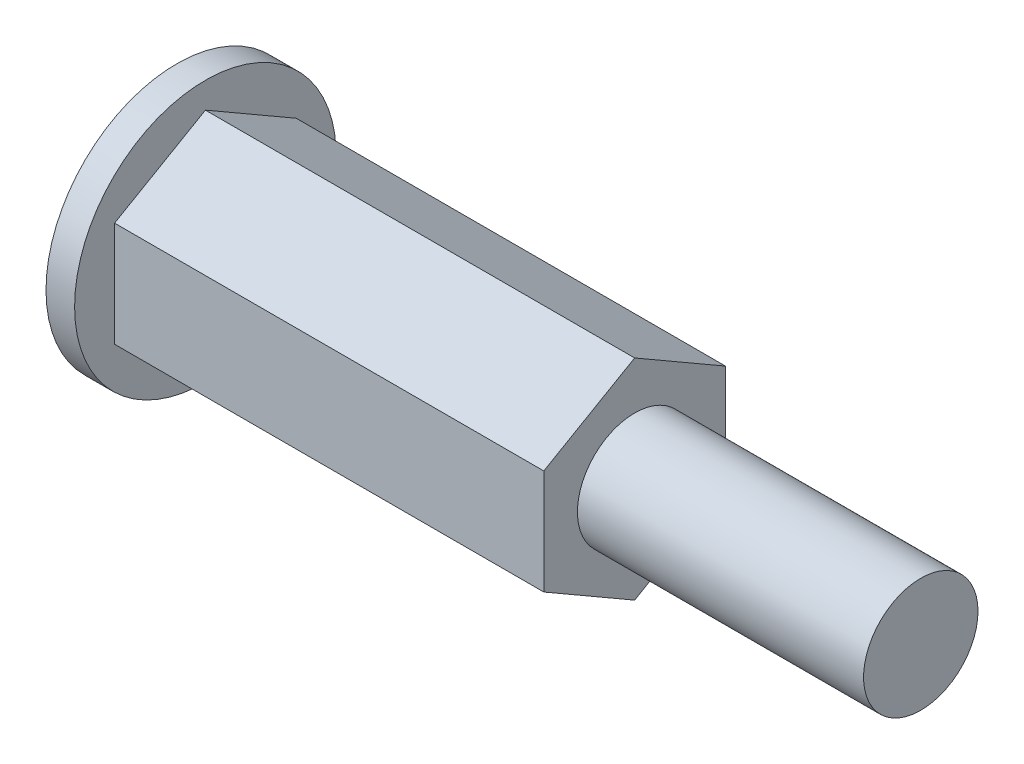
from build123d import *

# Parameters (mm, degrees)
SKETCH1_R           = 3.999
BOSS_EXTRUDE1_DEPTH = 50
SKETCH2_R           = 9.141
BOSS_EXTRUDE2_DEPTH = 2
BOSS_EXTRUDE3_DEPTH = 30


with BuildPart() as part:
    # Sketch1 → Boss-Extrude1 (new body)
    with BuildSketch(Plane.YZ):
        Circle(SKETCH1_R)
    extrude(amount=BOSS_EXTRUDE1_DEPTH)

    # Sketch2 → Boss-Extrude2 (add)
    with BuildSketch(Plane(origin=(0, 0, 0), x_dir=(0, -1, 0), z_dir=(-1, 0, 0))):
        Circle(SKETCH2_R)
    extrude(amount=BOSS_EXTRUDE2_DEPTH)

    # Sketch3 → Boss-Extrude3 (add)
    with BuildSketch(Plane.YZ):
        Polygon((3.665, 6.34796621), (-3.665, 6.34796621), (-7.33, 0), (-3.665, -6.34796621), (3.665, -6.34796621), (7.33, 0), align=None)
    extrude(amount=BOSS_EXTRUDE3_DEPTH)


solid = part.part
